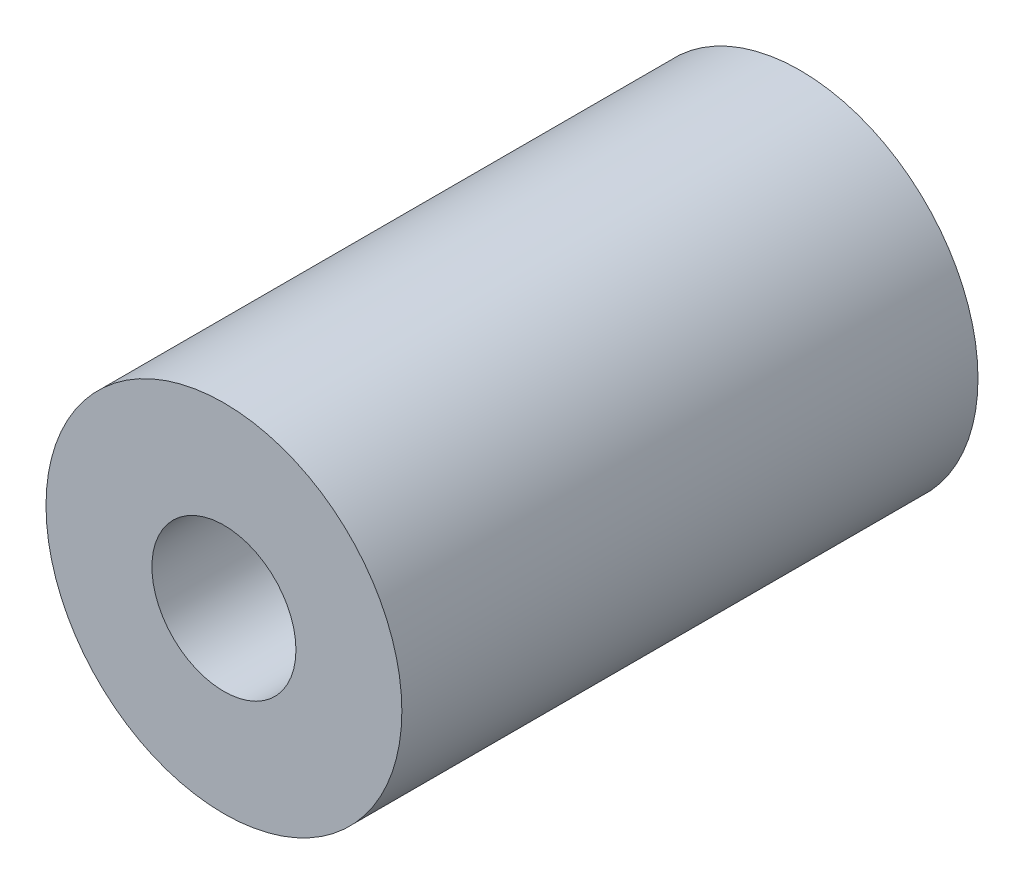
from build123d import *

# Parameters (mm, degrees)
SKETCH1_W           = 3.125
SKETCH1_H           = 3.75
SKETCH2_R           = 5.25
SKETCH2_R_2         = 2.125
BOSS_EXTRUDE1_DEPTH = 13.25


with BuildPart() as part:
    # Sketch1 → Revolve1 (revolve)
    with BuildSketch(Plane(origin=(0, 0, 0), x_dir=(1, 0, 0), z_dir=(0, 1, 0))):
        with Locations((3.6875, -1.875)):
            Rectangle(SKETCH1_W, SKETCH1_H)
    revolve(axis=Axis((0, 0, 0), (0, 0, 1)))

    # Sketch2 → Boss-Extrude1 (add)
    with BuildSketch(Plane.XY.offset(3.75)):
        Circle(SKETCH2_R)
        Circle(SKETCH2_R_2, mode=Mode.SUBTRACT)
    extrude(amount=BOSS_EXTRUDE1_DEPTH)


solid = part.part
